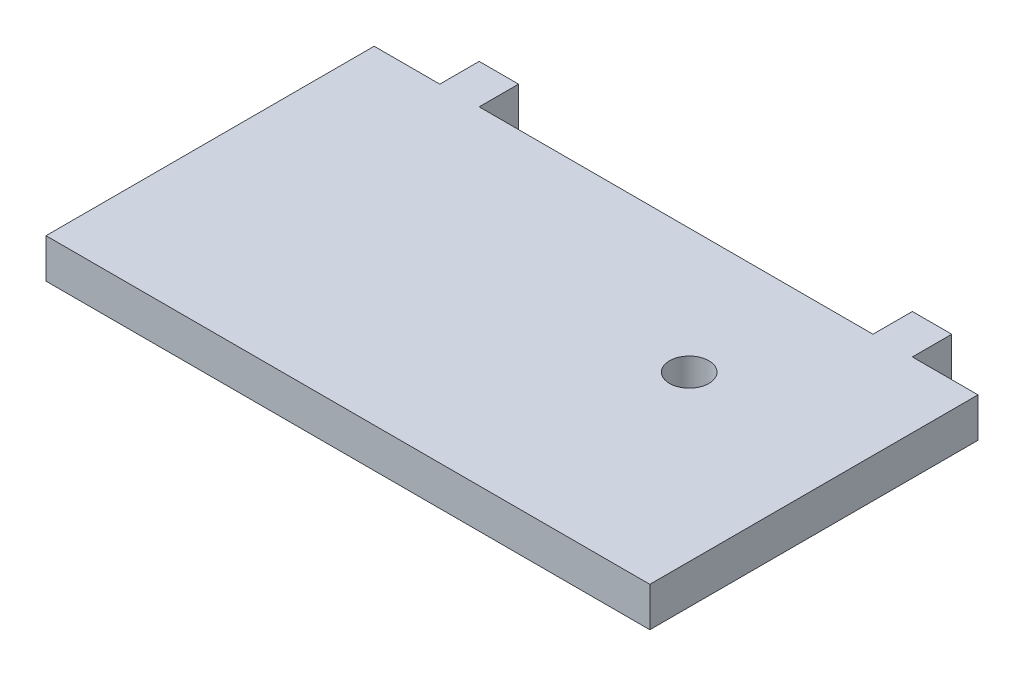
from build123d import *

# Parameters (mm, degrees)
SKETCH1_W           = 92
SKETCH1_H           = 6
BOSS_EXTRUDE1_DEPTH = 50
SKETCH2_W           = 6
SKETCH2_H           = 6
BOSS_EXTRUDE2_DEPTH = 6
SKETCH3_R           = 3
CUT_EXTRUDE1_DEPTH  = 6


with BuildPart() as part:
    # Sketch1 → Boss-Extrude1 (new body)
    with BuildSketch(Plane.XY):
        with Locations((0, 3)):
            Rectangle(SKETCH1_W, SKETCH1_H)
    extrude(amount=BOSS_EXTRUDE1_DEPTH)

    # Sketch2 → Boss-Extrude2 (add)
    with BuildSketch(Plane(origin=(0, 0, 0), x_dir=(-1, 0, 0), z_dir=(0, 0, -1))):
        with Locations((-33, 3)):
            Rectangle(SKETCH2_W, SKETCH2_H)
        with Locations((33, 3)):
            Rectangle(SKETCH2_W, SKETCH2_H)
    extrude(amount=BOSS_EXTRUDE2_DEPTH)

    # Sketch3 → Cut-Extrude1 (cut)
    with BuildSketch(Plane.XZ):
        with Locations((21, 19)):
            Circle(SKETCH3_R)
    extrude(amount=-CUT_EXTRUDE1_DEPTH, mode=Mode.SUBTRACT)


solid = part.part
